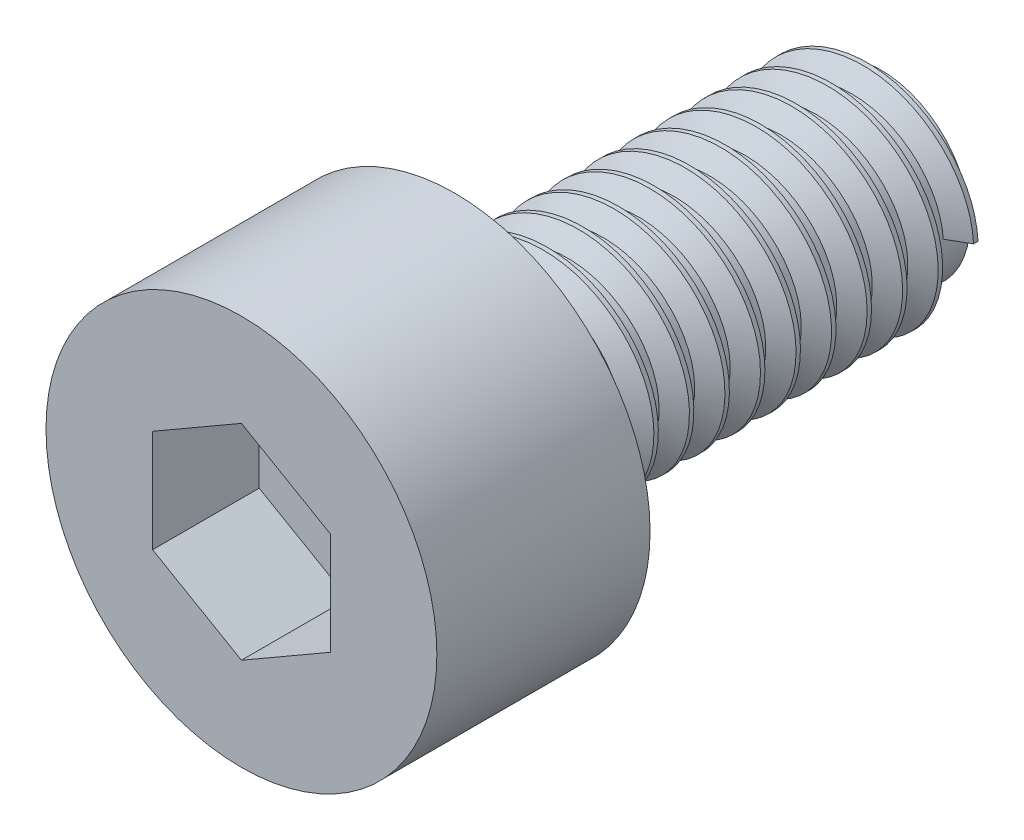
from build123d import *

# Parameters (mm, degrees)
SKETCH1_R           = 2.75
BOSS_EXTRUDE1_DEPTH = 3
SKETCH2_R           = 1.25
BOSS_EXTRUDE2_DEPTH = 6
CUT_EXTRUDE1_DEPTH  = 1.5
THREAD1_PITCH       = 0.5


with BuildPart() as part:
    # Sketch1 → Boss-Extrude1 (new body)
    with BuildSketch(Plane.XY):
        Circle(SKETCH1_R)
    extrude(amount=BOSS_EXTRUDE1_DEPTH)

    # Sketch2 → Boss-Extrude2 (add)
    with BuildSketch(Plane(origin=(0, 0, 0), x_dir=(-1, 0, 0), z_dir=(0, 0, -1))):
        Circle(SKETCH2_R)
    extrude(amount=BOSS_EXTRUDE2_DEPTH)

    # Sketch3 → Cut-Extrude1 (cut)
    with BuildSketch(Plane.XY.offset(3)):
        Polygon((0, 1.443375673), (-1.25, 0.721687836), (-1.25, -0.721687836), (0, -1.443375673), (1.25, -0.721687836), (1.25, 0.721687836), align=None)
    extrude(amount=-CUT_EXTRUDE1_DEPTH, mode=Mode.SUBTRACT)

    # Thread1: the profile of Thread Profile1 profile screwed along a right-hand helix of 12 turns, 6 arcs to a turn; built about Z, then put on its axis
    thread1_z = Axis((0, 0, 0), (0, 0, 1))
    thread1_corners = [(1.2497, 0, -0.000173205), (1.520632938, 0, 0.156249999), (1.520632937, 0, 0.218749999), (1.2497, 0, 0.375173204)]
    with BuildLine(mode=Mode.PRIVATE) as thread1_profile:
        Line(thread1_corners[0], thread1_corners[1])
        Line(thread1_corners[1], thread1_corners[2])
        Line(thread1_corners[2], thread1_corners[3])
        Line(thread1_corners[3], thread1_corners[0])
    thread1_cap = Face(thread1_profile.wire())
    thread1_turn_angles = [0, 30, 60, 90, 120, 150, 180, 210, 240, 270, 300, 330, 360]
    thread1_turn_weights = [1, 0.8660254037844387, 1, 0.8660254037844387, 1, 0.8660254037844387, 1, 0.8660254037844387, 1, 0.8660254037844387, 1, 0.8660254037844387, 1]
    thread1_turn_rails = [Edge.make_bspline([Vector(p[0], p[1], 0).rotate(thread1_z, thread1_turn_angles[k]) / thread1_turn_weights[k] + Vector(0, 0, p[2] + THREAD1_PITCH * thread1_turn_angles[k] / 360) for k in range(13)], [0, 0, 0, 1, 1, 2, 2, 3, 3, 4, 4, 5, 5, 6, 6, 6], 2, thread1_turn_weights) for p in thread1_corners]
    thread1_turn_sides = [Face.make_surface_from_curves(thread1_turn_rails[p[0]], thread1_turn_rails[p[1]]) for p in [(0, 1), (1, 2), (2, 3), (3, 0)]]
    thread1 = Plane(origin=(0, 0, -6), x_dir=(1, 0, 0), z_dir=(0, 0, 1)) * Solid(Shell([*[p.moved(Location((0, 0, THREAD1_PITCH * i))) for i in range(12) for p in thread1_turn_sides], thread1_cap, thread1_cap.rotate(thread1_z, 4320).moved(Location((0, 0, THREAD1_PITCH * 4320 / 360)))]))
    add(thread1)


solid = part.part
